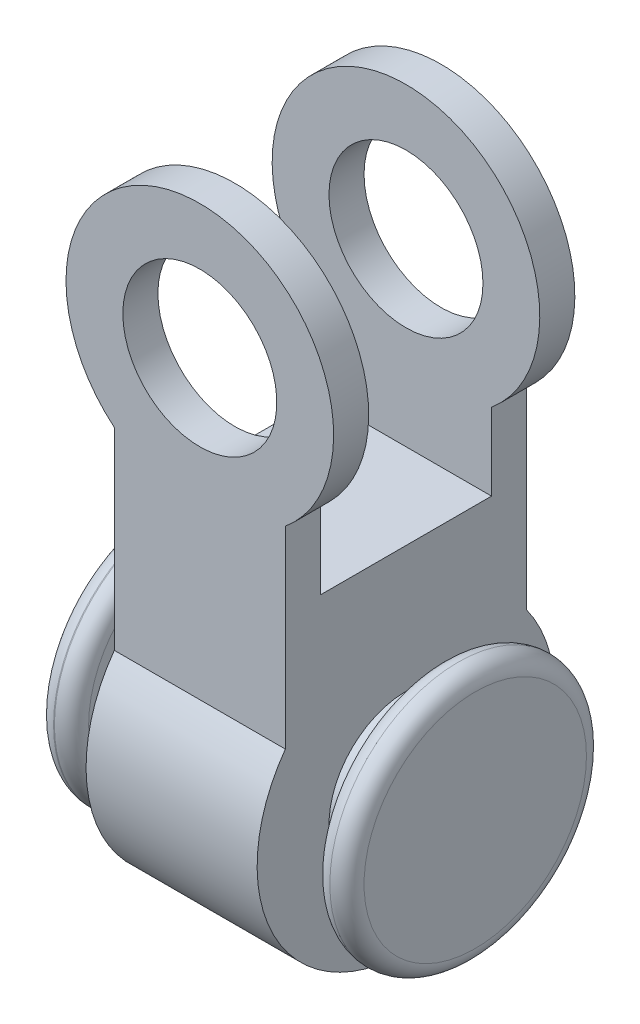
from build123d import *

# Parameters (mm, degrees)
SKETCH1_R                = 87
BOSS_EXTRUDE3_DEPTH      = 100
SKETCH2_R                = 45
BOSS_EXTRUDE4_DEPTH      = 20.5
SKETCH3_R                = 75
BOSS_EXTRUDE5_DEPTH      = 20
FILLET1_R                = 10
BOSS_EXTRUDE6_START      = 20.5
SKETCH4_R                = 45
BOSS_EXTRUDE6_DEPTH      = 20.5
BOSS_EXTRUDE7_START      = 20.5
SKETCH5_R                = 75
BOSS_EXTRUDE7_DEPTH      = 20.5
FILLET2_R                = 10
BOSS_EXTRUDE8_REACH      = 241.969
BOSS_EXTRUDE8_END_RADIUS = 87
SKETCH6_W                = 100
SKETCH6_H                = 141
SKETCH9_R                = 45
BOSS_EXTRUDE10_DEPTH     = 141
CUT_EXTRUDE2_DEPTH       = 367.4016204
CUT_EXTRUDE2_DEPTH_BACK  = 367.4016204
SKETCH21_W               = 216.769628827
SKETCH21_H               = 100


with BuildPart() as part:
    # Sketch1 → Boss-Extrude3 (new body)
    with BuildSketch(Plane(origin=(0, 0, 0), x_dir=(0, 0, -1), z_dir=(1, 0, 0))):
        Circle(SKETCH1_R)
    extrude(amount=BOSS_EXTRUDE3_DEPTH)

    # Sketch2 → Boss-Extrude4 (add)
    with BuildSketch(Plane(origin=(100, 0, 0), x_dir=(0, 0, -1), z_dir=(1, 0, 0))):
        Circle(SKETCH2_R)
    extrude(amount=BOSS_EXTRUDE4_DEPTH)

    # Sketch3 → Boss-Extrude5 (add)
    with BuildSketch(Plane(origin=(120.5, 0, 0), x_dir=(0, 0, -1), z_dir=(1, 0, 0))):
        Circle(SKETCH3_R)
    extrude(amount=BOSS_EXTRUDE5_DEPTH)

    # Fillet1
    fillet1_edges = [part.edges().sort_by_distance(p)[0] for p in [
        (140.5, 0, 75),
        (120.5, 0, 75),
    ]]
    fillet(fillet1_edges, radius=FILLET1_R - 0.0001)  # a hair under: the kernel refuses the full size

    # Sketch4 → Boss-Extrude6 (add)
    with BuildSketch(Plane.ZY.offset(BOSS_EXTRUDE6_START)):
        with Locations(Location((0, 0, 0), (0, 0, 180))):
            Circle(SKETCH4_R)
    extrude(amount=-BOSS_EXTRUDE6_DEPTH)

    # Sketch5 → Boss-Extrude7 (add)
    with BuildSketch(Plane.ZY.offset(20.5).offset(BOSS_EXTRUDE7_START)):
        Circle(SKETCH5_R)
    extrude(amount=-BOSS_EXTRUDE7_DEPTH)

    # Fillet2
    fillet2_edges = [part.edges().sort_by_distance(p)[0] for p in [
        (-20.5, 0, -75),
        (-41, 0, -75),
    ]]
    fillet(fillet2_edges, radius=FILLET2_R)

    # Boss-Extrude8: up to this cylinder (the profile starts outside it)
    boss_extrude8_end = Plane(origin=(50, 0, 0), z_dir=(-1, 0, 0)) * Cylinder(BOSS_EXTRUDE8_END_RADIUS, 658.938, mode=Mode.PRIVATE)
    # Sketch6 → Boss-Extrude8 (add, up to the surface)
    with BuildSketch(Plane(origin=(0, 87, 0), x_dir=(1, 0, 0), z_dir=(0, 1, 0)), mode=Mode.PRIVATE) as boss_extrude8_sk1:
        with Locations((50, 0)):
            Rectangle(SKETCH6_W, SKETCH6_H)
    boss_extrude8_tool1 = extrude(boss_extrude8_sk1.sketch, amount=-BOSS_EXTRUDE8_REACH, mode=Mode.PRIVATE) - boss_extrude8_end
    add(boss_extrude8_tool1.solids().sort_by_distance((50, 87, 0))[0])
    add(boss_extrude8_tool1.solids().sort_by_distance((50, 87, 0))[1])

    # Sketch9 → Boss-Extrude10 (add)
    with BuildSketch(Plane(origin=(0, 0, -70.5), x_dir=(-1, 0, 0), z_dir=(0, 0, -1))):
        with BuildLine():
            Line((-100, 87), (0, 87))
            Line((0, 87), (0, 163.846653629))
            ThreePointArc((0, 163.846653629), (-50, 302.220362308), (-100, 163.846653629))
            Line((-100, 163.846653629), (-100, 87))
        make_face()
        with Locations((-50, 224)):
            Circle(SKETCH9_R, mode=Mode.SUBTRACT)
    extrude(amount=-BOSS_EXTRUDE10_DEPTH)

    # Sketch21 → Cut-Extrude2 (cut, two sides: drawn at the far end of the back side and taken through both)
    with BuildSketch(Plane(origin=(147, 0, 0), x_dir=(0, 1, 0), z_dir=(-1, 0, 0)).offset(-CUT_EXTRUDE2_DEPTH_BACK)):
        with Locations((227.184814414, 0)):
            Rectangle(SKETCH21_W, SKETCH21_H)
    extrude(amount=CUT_EXTRUDE2_DEPTH + CUT_EXTRUDE2_DEPTH_BACK, mode=Mode.SUBTRACT)


solid = part.part
